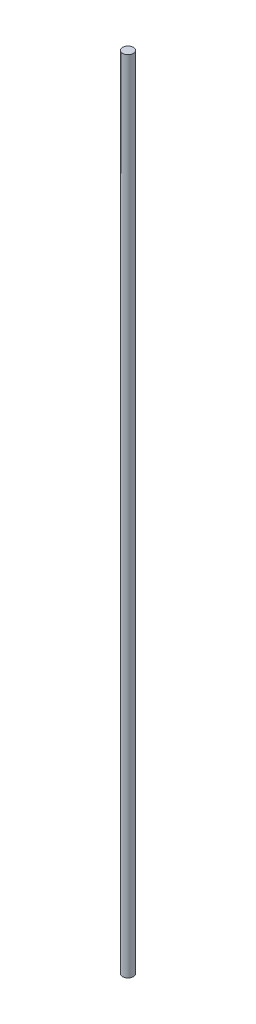
from build123d import *

# Parameters (mm, degrees)
SKETCH1_R           = 4
BOSS_EXTRUDE1_DEPTH = 300


with BuildPart() as part:
    # Sketch1 → Boss-Extrude1 (new, symmetric)
    with BuildSketch(Plane(origin=(0, 0, 0), x_dir=(1, 0, 0), z_dir=(0, 1, 0))):
        Circle(SKETCH1_R)
    extrude(amount=BOSS_EXTRUDE1_DEPTH, both=True)


solid = part.part
